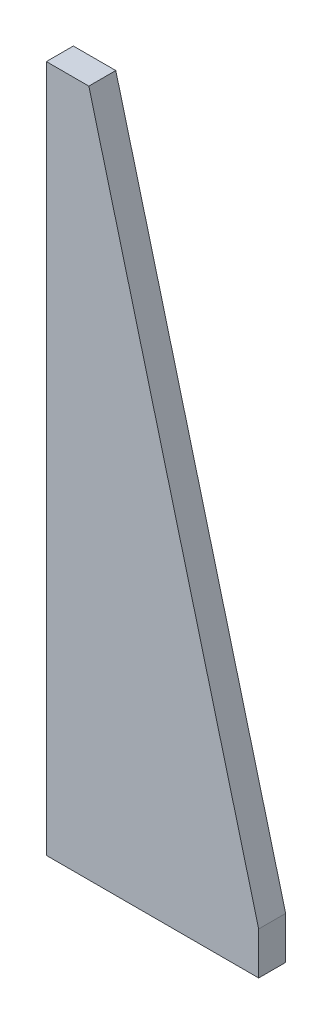
from build123d import *

# Parameters (mm, degrees)
FLANGE_BASE1_DEPTH = 6.35


# Sheet-metal steps are written as plain solids
with BuildPart() as part:
    # Esboço1 → Flange-base1 (new body)
    with BuildSketch(Plane.XY):
        Polygon((0, 0), (50, 0), (50, 10), (10, 161.89), (0, 161.89), align=None)
    extrude(amount=-FLANGE_BASE1_DEPTH)


solid = part.part
